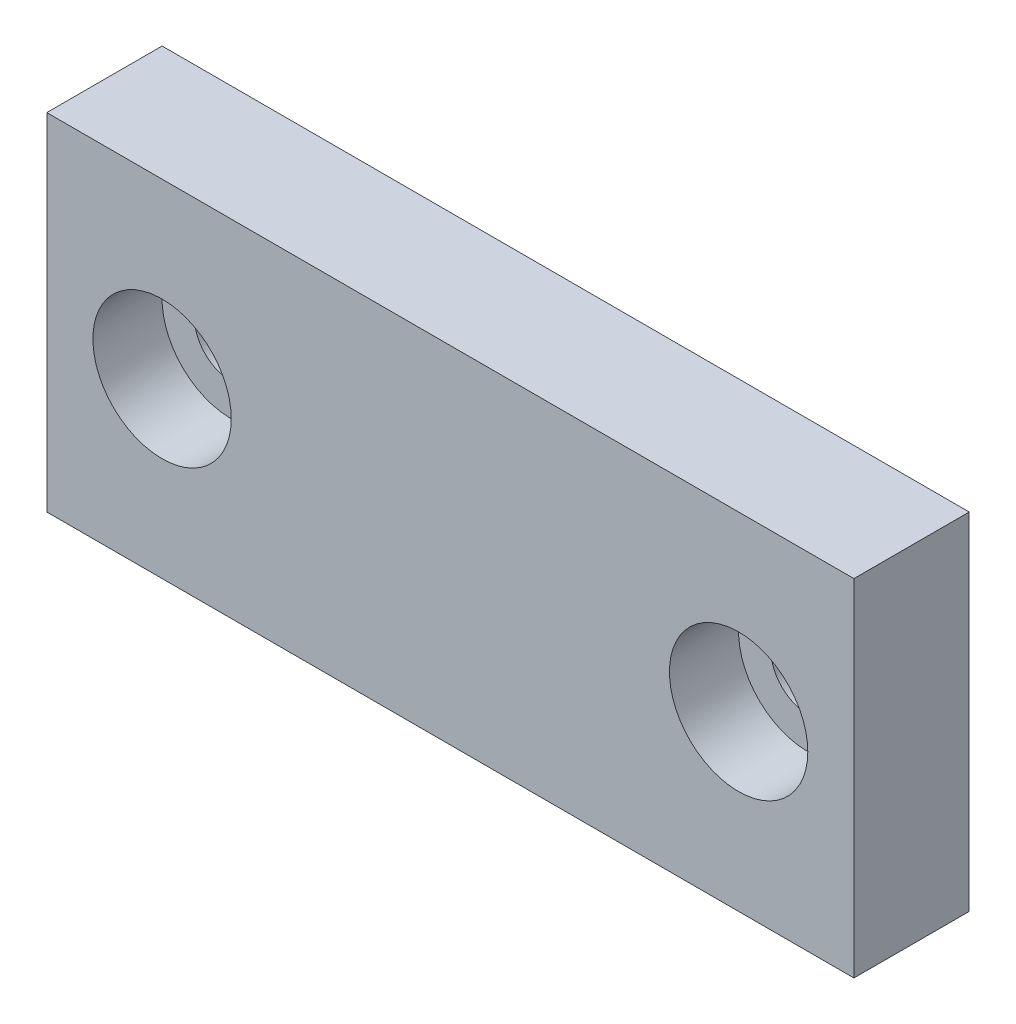
from build123d import *

# Parameters (mm, degrees)
SKETCH1_W           = 70
SKETCH1_H           = 30
BOSS_EXTRUDE1_DEPTH = 10
SKETCH2_R           = 6
CUT_EXTRUDE1_DEPTH  = 6
SKETCH3_R           = 3.2
CUT_EXTRUDE2_DEPTH  = 77.393717019


with BuildPart() as part:
    # Sketch1 → Boss-Extrude1 (new body)
    with BuildSketch(Plane.XY):
        with Locations((35, -15)):
            Rectangle(SKETCH1_W, SKETCH1_H)
    extrude(amount=BOSS_EXTRUDE1_DEPTH)

    # Sketch2 → Cut-Extrude1 (cut)
    with BuildSketch(Plane.XY.offset(10)):
        with Locations((10, -15)):
            Circle(SKETCH2_R)
        with Locations((60, -15)):
            Circle(SKETCH2_R)
    extrude(amount=-CUT_EXTRUDE1_DEPTH, mode=Mode.SUBTRACT)

    # Sketch3 → Cut-Extrude2 (cut, through all)
    with BuildSketch(Plane.XY.offset(4)):
        with Locations((10, -15)):
            Circle(SKETCH3_R)
        with Locations((60, -15)):
            Circle(SKETCH3_R)
    extrude(amount=-CUT_EXTRUDE2_DEPTH, mode=Mode.SUBTRACT)


solid = part.part
